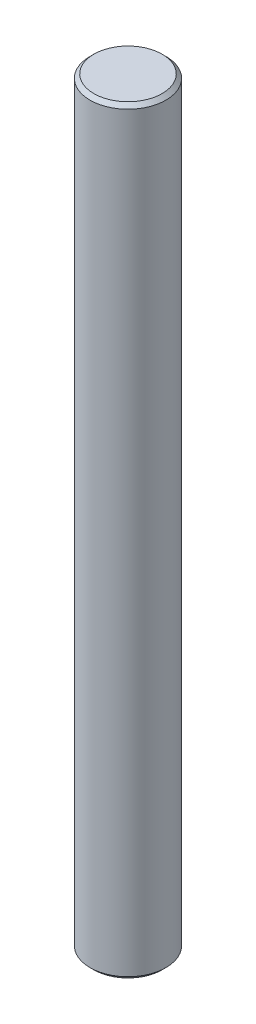
from build123d import *

# Parameters (mm, degrees)
MAINSKETCH_R        = 5
BOSS_EXTRUDE1_DEPTH = 100
CHAMFER1_SIZE       = 0.5


with BuildPart() as part:
    # MainSketch → Boss-Extrude1 (new body)
    with BuildSketch(Plane(origin=(0, 0, 0), x_dir=(1, 0, 0), z_dir=(0, 1, 0))):
        Circle(MAINSKETCH_R)
    extrude(amount=BOSS_EXTRUDE1_DEPTH)

    # Chamfer1
    chamfer1_edges = [part.edges().sort_by_distance(p)[0] for p in [
        (-5, 100, 0),
        (-5, 0, 0),
    ]]
    chamfer(chamfer1_edges, length=CHAMFER1_SIZE)


solid = part.part
